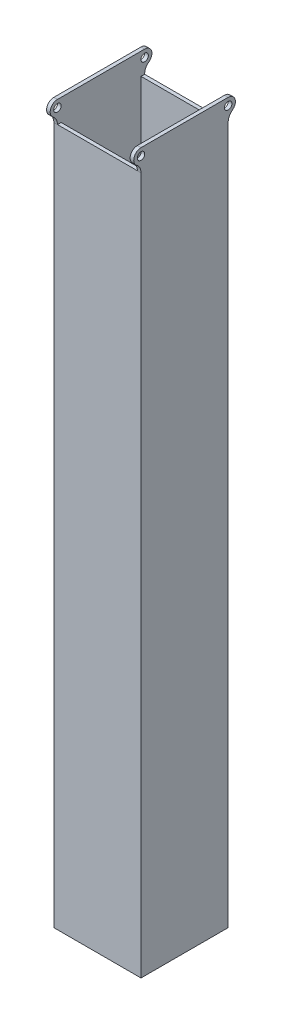
from build123d import *

# Parameters (mm, degrees)
SKETCH1_W             = 38.1
SKETCH1_H             = 38.1
SKETCH1_W_2           = 34.925
SKETCH1_H_2           = 34.925
EXTRUDE_THIN1_DEPTH   = 152.4
BOSS_EXTRUDE1_DEPTH   = 1.5875
BOSS_EXTRUDE2_START   = 34.925
BOSS_EXTRUDE2_DEPTH   = 1.5875
F_4_CLEARANCE_HOLE1_D = 3.2639


# Read off the part's stored shape, not the designer's step: Boss-Extrude2
with BuildPart() as part:
    # Sketch1 → Extrude-Thin1 (new, symmetric)
    with BuildSketch(Plane(origin=(0, 0, 0), x_dir=(1, 0, 0), z_dir=(0, 1, 0))):
        Rectangle(SKETCH1_W, SKETCH1_H)
        Rectangle(SKETCH1_W_2, SKETCH1_H_2, mode=Mode.SUBTRACT)
    extrude(amount=EXTRUDE_THIN1_DEPTH, both=True)

    # Sketch3 → Boss-Extrude1 (add)
    with BuildSketch(Plane(origin=(-17.4625, 0, 0), x_dir=(0, 0, -1), z_dir=(1, 0, 0))):
        with BuildLine():
            Line((-19.05, 152.4), (19.05, 152.4))
            ThreePointArc((19.05, 152.4), (19.552790503, 154.529854749), (20.955, 156.21))
            ThreePointArc((20.955, 156.21), (22.062069471, 159.754023157), (19.05, 161.925))
            Line((19.05, 161.925), (-19.05, 161.925))
            ThreePointArc((-19.05, 161.925), (-22.062069471, 159.754023157), (-20.955, 156.21))
            ThreePointArc((-20.955, 156.21), (-19.552790503, 154.529854749), (-19.05, 152.4))
        make_face()
    extrude(amount=-BOSS_EXTRUDE1_DEPTH)

    # Boss-Extrude2 outline → Boss-Extrude2 (add)
    with BuildSketch(Plane(origin=(-17.4625, 0, 0), x_dir=(0, 0, -1), z_dir=(1, 0, 0)).offset(BOSS_EXTRUDE2_START)):
        with BuildLine():
            Line((19.05, 161.925), (-19.05, 161.925))
            ThreePointArc((-19.05, 161.925), (-22.062069471, 159.754023157), (-20.955, 156.21))
            ThreePointArc((-20.955, 156.21), (-19.552790503, 154.529854749), (-19.05, 152.4))
            Line((-19.05, 152.4), (19.05, 152.4))
            ThreePointArc((19.05, 152.4), (19.552790503, 154.529854749), (20.955, 156.21))
            ThreePointArc((20.955, 156.21), (22.062069471, 159.754023157), (19.05, 161.925))
        make_face()
    extrude(amount=BOSS_EXTRUDE2_DEPTH)

    # #4 Clearance Hole1 (through all)
    with Locations(Plane.ZY.offset(19.05)):
        with Locations((-19.05, 158.75), (19.05, 158.75)):
            Hole(F_4_CLEARANCE_HOLE1_D / 2)


solid = part.part
